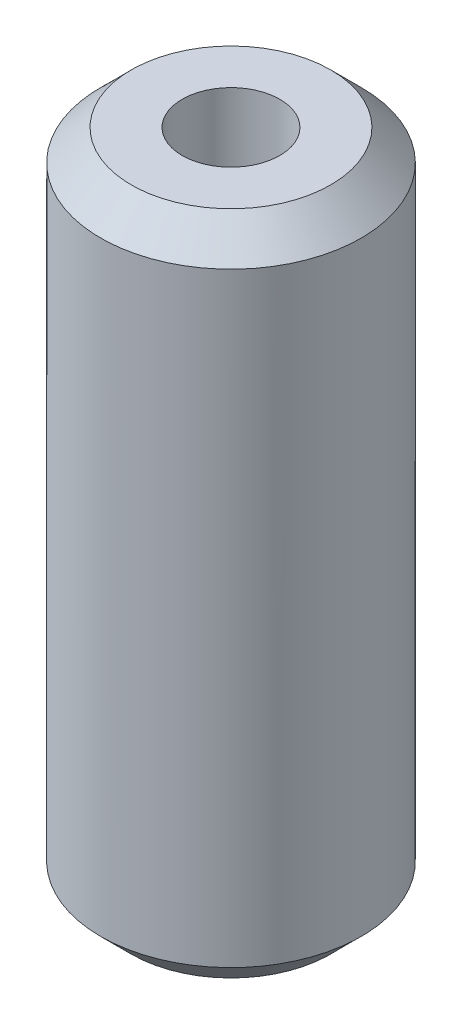
from build123d import *

# Parameters (mm, degrees)
SKETCH1_R           = 25
BOSS_EXTRUDE1_DEPTH = 127.759392535
SKETCH2_R           = 9.355426916
CUT_EXTRUDE1_DEPTH  = 133.561164678
CHAMFER1_SIZE       = 5.880647485


with BuildPart() as part:
    # Sketch1 → Boss-Extrude1 (new body)
    with BuildSketch(Plane(origin=(0, 0, 0), x_dir=(1, 0, 0), z_dir=(0, 1, 0))):
        Circle(SKETCH1_R)
    extrude(amount=BOSS_EXTRUDE1_DEPTH)

    # Sketch2 → Cut-Extrude1 (cut, through all)
    with BuildSketch(Plane(origin=(0, 0, 0), x_dir=(1, 0, 0), z_dir=(0, 1, 0))):
        Circle(SKETCH2_R)
    extrude(amount=CUT_EXTRUDE1_DEPTH, mode=Mode.SUBTRACT)

    # Chamfer1
    chamfer1_edges = [part.edges().sort_by_distance(p)[0] for p in [
        (-25, 127.759392535, 0),
        (-25, 0, 0),
    ]]
    chamfer(chamfer1_edges, length=CHAMFER1_SIZE)


solid = part.part
